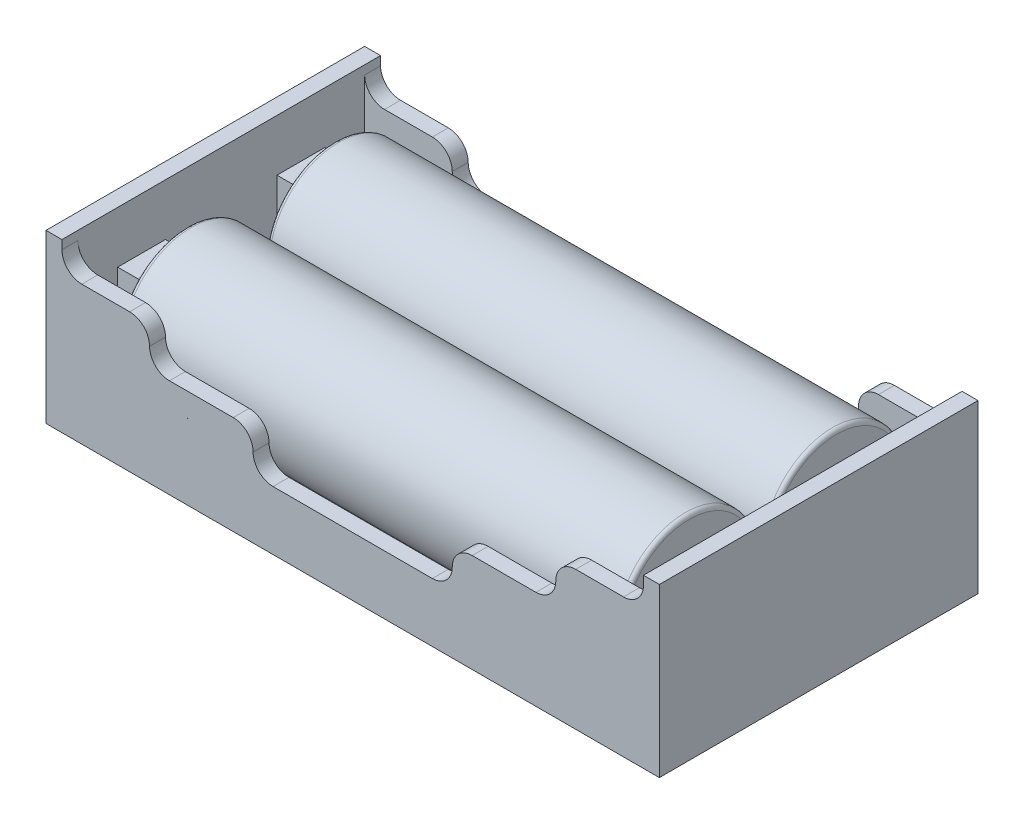
from build123d import *

# Parameters (mm, degrees)
SZKIC1_W                                = 77
SZKIC1_H                                = 40
SZKIC1_R                                = 1.5
DODANIE_WYCI_GNI_CIE1_DEPTH             = 2
SZKIC2_W                                = 77
SZKIC2_H                                = 40
SZKIC2_W_2                              = 73
SZKIC2_H_2                              = 36
DODANIE_WYCI_GNI_CIE2_DEPTH             = 19
WYTNIJ_WYCI_GNI_CIE1_DEPTH              = 60.356970947
ZAOKR_GLENIE1_R                         = 2.5
SZKIC4_W                                = 77
SZKIC4_H                                = 1
DODANIE_WYCI_GNI_CIE3_DEPTH             = 10
SZKIC5_W                                = 6
SZKIC5_H                                = 10
DODANIE_WYCI_GNI_CIE4_DEPTH             = 5
ZAOKR_GLENIE2_R                         = 2.5
ZAOKR_GLENIE2_OF_LUSTRO1_R              = 2.5
LUSTRO2_START                           = -13
LUSTRO2_DEPTH                           = 6
LUSTRO2_START_2                         = 7
LUSTRO2_2_DEPTH                         = 6
DODANIE_WYCI_GNI_CIE5_REACH             = 50.2
SZKIC6_R                                = 8.7
DODANIE_WYCI_GNI_CIE5_DIRECTION_2_REACH = 50.2
ZAOKR_GLENIE3_R                         = 0.5


# Read off the part's stored shape, not the designer's step: Lustro2
with BuildPart() as part:
    # Szkic1 → Dodanie-wyciągnięcie1 (new body)
    with BuildSketch(Plane(origin=(0, 0, 0), x_dir=(1, 0, 0), z_dir=(0, 1, 0))):
        Rectangle(SZKIC1_W, SZKIC1_H)
        with Locations(Location((27.5, 9.5, 0), (0, 0, 270))):
            Circle(SZKIC1_R, mode=Mode.SUBTRACT)
        with Locations(Location((27.5, -9.5, 0), (0, 0, 90))):
            Circle(SZKIC1_R, mode=Mode.SUBTRACT)
        with Locations(Location((-27.5, -9.5, 0), (0, 0, 270))):
            Circle(SZKIC1_R, mode=Mode.SUBTRACT)
        with Locations(Location((-27.5, 9.5, 0), (0, 0, 90))):
            Circle(SZKIC1_R, mode=Mode.SUBTRACT)
    extrude(amount=DODANIE_WYCI_GNI_CIE1_DEPTH)

    # Szkic2 → Dodanie-wyciągnięcie2 (add)
    with BuildSketch(Plane(origin=(0, 2, 0), x_dir=(1, 0, 0), z_dir=(0, 1, 0))):
        Rectangle(SZKIC2_W, SZKIC2_H)
        Rectangle(SZKIC2_W_2, SZKIC2_H_2, mode=Mode.SUBTRACT)
    extrude(amount=DODANIE_WYCI_GNI_CIE2_DEPTH)

    # Szkic3 → Wytnij-wyciągnięcie1 (cut, through all)
    with BuildSketch(Plane.XY.offset(20)):
        Polygon((-12.5, 7.396479256), (12.5, 7.396479256), (12.5, 12.396479256), (25.5, 12.396479256), (25.5, 17.396479256), (36.5, 17.396479256), (36.5, 21), (-36.5, 21), (-36.5, 17.396479256), (-25.5, 17.396479256), (-25.5, 12.396479256), (-12.5, 12.396479256), align=None)
    extrude(amount=-WYTNIJ_WYCI_GNI_CIE1_DEPTH, mode=Mode.SUBTRACT)

    # Zaokrąglenie1
    zaokr_glenie1_edges = [part.edges().sort_by_distance(p)[0] for p in [
        (36.5, 17.396479256, 19),
        (25.5, 17.396479256, 19),
        (25.5, 12.396479256, 19),
        (12.5, 12.396479256, 19),
        (12.5, 7.396479256, 19),
        (-36.5, 17.396479256, 19),
        (-25.5, 17.396479256, 19),
        (-25.5, 12.396479256, 19),
        (-12.5, 12.396479256, 19),
        (-12.5, 7.396479256, 19),
        (12.5, 7.396479256, -19),
        (12.5, 12.396479256, -19),
        (25.5, 12.396479256, -19),
        (36.5, 17.396479256, -19),
        (25.5, 17.396479256, -19),
        (-12.5, 7.396479256, -19),
        (-12.5, 12.396479256, -19),
        (-36.5, 17.396479256, -19),
        (-25.5, 17.396479256, -19),
        (-25.5, 12.396479256, -19),
    ]]
    fillet(zaokr_glenie1_edges, radius=ZAOKR_GLENIE1_R - 0.0001)  # a hair under: the kernel refuses the full size

    # Szkic4 → Dodanie-wyciągnięcie3 (add)
    with BuildSketch(Plane(origin=(0, 2, 0), x_dir=(1, 0, 0), z_dir=(0, 1, 0))):
        Rectangle(SZKIC4_W, SZKIC4_H)
    extrude(amount=DODANIE_WYCI_GNI_CIE3_DEPTH)

    # Szkic5 → Dodanie-wyciągnięcie4 (add)
    with BuildSketch(Plane(origin=(-36.5, 0, 0), x_dir=(0, 0, -1), z_dir=(1, 0, 0))):
        with Locations((-10, 9.5)):
            Rectangle(SZKIC5_W, SZKIC5_H)
    dodanie_wyci_gni_cie4 = extrude(amount=DODANIE_WYCI_GNI_CIE4_DEPTH)

    # Zaokrąglenie2
    zaokr_glenie2_edges = [part.edges().sort_by_distance(p)[0] for p in [
        (-31.5, 14.5, 10),
    ]]
    fillet(zaokr_glenie2_edges, radius=ZAOKR_GLENIE2_R)

    # Lustro1: Dodanie-wyciągnięcie4 across plane
    add(dodanie_wyci_gni_cie4.mirror(Plane.XY))

    # Zaokrąglenie2 of Lustro1
    zaokr_glenie2_of_lustro1_edges = [part.edges().sort_by_distance(p)[0] for p in [
        (-31.5, 14.5, -10),
    ]]
    fillet(zaokr_glenie2_of_lustro1_edges, radius=ZAOKR_GLENIE2_OF_LUSTRO1_R)

    # Lustro2 outline → Lustro2 (add)
    with BuildSketch(Plane.XY.offset(LUSTRO2_START)):
        with BuildLine():
            Line((36.5, 14.5), (34, 14.5))
            ThreePointArc((34, 14.5), (32.232233047, 13.767766953), (31.5, 12))
            Line((31.5, 12), (31.5, 4.5))
            Line((31.5, 4.5), (36.5, 4.5))
            Line((36.5, 4.5), (36.5, 14.5))
        make_face()
    extrude(amount=LUSTRO2_DEPTH)

    # Lustro2 2 outline → Lustro2 2 (add)
    with BuildSketch(Plane.XY.offset(LUSTRO2_START_2)):
        with BuildLine():
            Line((36.5, 14.5), (34, 14.5))
            ThreePointArc((34, 14.5), (32.232233047, 13.767766953), (31.5, 12))
            Line((31.5, 12), (31.5, 4.5))
            Line((31.5, 4.5), (36.5, 4.5))
            Line((36.5, 4.5), (36.5, 14.5))
        make_face()
    extrude(amount=LUSTRO2_2_DEPTH)

    # Dodanie-wyciągnięcie5: up to this face of the body (flat: up to its plane)
    dodanie_wyci_gni_cie5_end = Plane(part.part.faces().sort_by_distance((31.5, 8.25, 10))[0])
    # Szkic6 → Dodanie-wyciągnięcie5 (add, up to the picked face)
    with BuildSketch(Plane(origin=(0, 0, 0), x_dir=(0, 0, -1), z_dir=(1, 0, 0)), mode=Mode.PRIVATE) as dodanie_wyci_gni_cie5_sk1:
        with Locations(Location((-9.25, 11, 0), (0, 0, 180))):
            Circle(SZKIC6_R)
    dodanie_wyci_gni_cie5_tool1 = split(extrude(dodanie_wyci_gni_cie5_sk1.sketch, amount=DODANIE_WYCI_GNI_CIE5_REACH, mode=Mode.PRIVATE), bisect_by=dodanie_wyci_gni_cie5_end, keep=Keep.BOTH, mode=Mode.PRIVATE)
    # Szkic6 → Dodanie-wyciągnięcie5 (add, up to the picked face)
    with BuildSketch(Plane(origin=(0, 0, 0), x_dir=(0, 0, -1), z_dir=(1, 0, 0)), mode=Mode.PRIVATE) as dodanie_wyci_gni_cie5_sk2:
        with Locations(Location((9.25, 11, 0), (0, 0, 180))):
            Circle(SZKIC6_R)
    dodanie_wyci_gni_cie5_tool2 = split(extrude(dodanie_wyci_gni_cie5_sk2.sketch, amount=DODANIE_WYCI_GNI_CIE5_REACH, mode=Mode.PRIVATE), bisect_by=dodanie_wyci_gni_cie5_end, keep=Keep.BOTH, mode=Mode.PRIVATE)
    add(dodanie_wyci_gni_cie5_tool1.solids().sort_by(Axis((0, 11, 9.25), (1, 0, 0)))[0])
    add(dodanie_wyci_gni_cie5_tool2.solids().sort_by(Axis((0, 11, -9.25), (1, 0, 0)))[0])

    # Dodanie-wyciągnięcie5 direction 2: up to this face of the body (flat: up to its plane)
    dodanie_wyci_gni_cie5_direction_2_end = Plane(part.part.faces().sort_by_distance((-31.5, 8.25, 10))[0])
    # Szkic6 → Dodanie-wyciągnięcie5 direction 2 (add, up to the picked face)
    with BuildSketch(Plane(origin=(0, 0, 0), x_dir=(0, 0, -1), z_dir=(1, 0, 0)), mode=Mode.PRIVATE) as dodanie_wyci_gni_cie5_direction_2_sk1:
        with Locations(Location((-9.25, 11, 0), (0, 0, 180))):
            Circle(SZKIC6_R)
    dodanie_wyci_gni_cie5_direction_2_tool1 = split(extrude(dodanie_wyci_gni_cie5_direction_2_sk1.sketch, amount=-DODANIE_WYCI_GNI_CIE5_DIRECTION_2_REACH, mode=Mode.PRIVATE), bisect_by=dodanie_wyci_gni_cie5_direction_2_end, keep=Keep.BOTH, mode=Mode.PRIVATE)
    # Szkic6 → Dodanie-wyciągnięcie5 direction 2 (add, up to the picked face)
    with BuildSketch(Plane(origin=(0, 0, 0), x_dir=(0, 0, -1), z_dir=(1, 0, 0)), mode=Mode.PRIVATE) as dodanie_wyci_gni_cie5_direction_2_sk2:
        with Locations(Location((9.25, 11, 0), (0, 0, 180))):
            Circle(SZKIC6_R)
    dodanie_wyci_gni_cie5_direction_2_tool2 = split(extrude(dodanie_wyci_gni_cie5_direction_2_sk2.sketch, amount=-DODANIE_WYCI_GNI_CIE5_DIRECTION_2_REACH, mode=Mode.PRIVATE), bisect_by=dodanie_wyci_gni_cie5_direction_2_end, keep=Keep.BOTH, mode=Mode.PRIVATE)
    add(dodanie_wyci_gni_cie5_direction_2_tool1.solids().sort_by(Axis((0, 11, 9.25), (-1, 0, 0)))[0])
    add(dodanie_wyci_gni_cie5_direction_2_tool2.solids().sort_by(Axis((0, 11, -9.25), (-1, 0, 0)))[0])

    # Zaokrąglenie3
    zaokr_glenie3_edges = [part.edges().sort_by_distance(p)[0] for p in [
        (-31.5, 11, 0.55),
        (31.5, 11, 0.55),
        (31.5, 11, -17.95),
        (-31.5, 11, -17.95),
    ]]
    fillet(zaokr_glenie3_edges, radius=ZAOKR_GLENIE3_R)


solid = part.part
